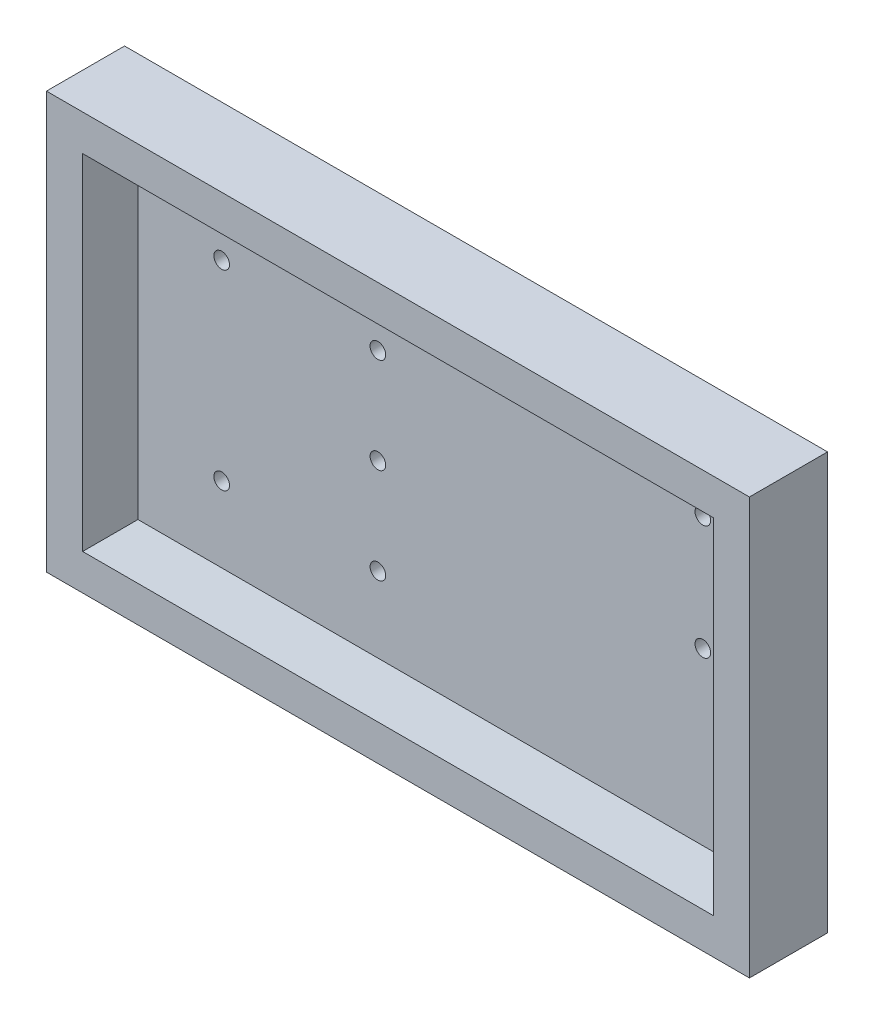
from build123d import *

# Parameters (mm, degrees)
SKETCH1_W           = 135
SKETCH1_H           = 80
BOSS_EXTRUDE1_DEPTH = 40
SKETCH2_R           = 1.5
CUT_EXTRUDE1_DEPTH  = 10
SKETCH4_W           = 135
SKETCH4_H           = 25
CUT_EXTRUDE2_DEPTH  = 100


with BuildPart() as part:
    # Sketch1 → Boss-Extrude1 (new body)
    with BuildSketch(Plane.XY):
        with Locations((67.5, 40)):
            Rectangle(SKETCH1_W, SKETCH1_H)
    extrude(amount=-BOSS_EXTRUDE1_DEPTH)

    # Sketch2 → Cut-Extrude1 (cut)
    with BuildSketch(Plane(origin=(0, 0, -40), x_dir=(-1, 0, 0), z_dir=(0, 0, -1))):
        with Locations((-53.3, 40)):
            Circle(SKETCH2_R)
        with Locations((-53.3, 58.35)):
            Circle(SKETCH2_R)
        with Locations((-53.3, 21.65)):
            Circle(SKETCH2_R)
        with Locations((-23.3, 58.35)):
            Circle(SKETCH2_R)
        with Locations((-23.3, 21.65)):
            Circle(SKETCH2_R)
        with Locations((-115.7, 40)):
            Circle(SKETCH2_R)
        with Locations((-115.7, 62)):
            Circle(SKETCH2_R)
    extrude(amount=-CUT_EXTRUDE1_DEPTH, mode=Mode.SUBTRACT)

    # Cavity1: read off the stored shape, not the designer's step
    # Cavity1: loft between two sections, ruled curve by curve
    cavity1_from = [
        Edge.make_line((128.706, 6.25125, 0), (128.706, 73.74875, 0)),
        Edge.make_line((6.294, 6.25125, 0), (128.706, 6.25125, 0)),
        Edge.make_line((6.294, 73.74875, 0), (6.294, 6.25125, 0)),
        Edge.make_line((128.706, 73.74875, 0), (6.294, 73.74875, 0)),
    ]
    cavity1_to = [
        Edge.make_line((127.780327673, 7.181504864, -35.35), (127.780327673, 72.818495136, -35.35)),
        Edge.make_line((7.219672327, 7.181504864, -35.35), (127.780327673, 7.181504864, -35.35)),
        Edge.make_line((7.219672327, 72.818495136, -35.35), (7.219672327, 7.181504864, -35.35)),
        Edge.make_line((127.780327673, 72.818495136, -35.35), (7.219672327, 72.818495136, -35.35)),
    ]
    cavity1 = Solid(Shell([*[Face.make_surface_from_curves(cavity1_from[k], cavity1_to[k]) for k in range(4)], Face(Wire(cavity1_from)), Face(Wire(cavity1_to))]))
    add(cavity1, mode=Mode.SUBTRACT)

    # Sketch4 → Cut-Extrude2 (cut)
    with BuildSketch(Plane(origin=(0, 80, 0), x_dir=(1, 0, 0), z_dir=(0, 1, 0))):
        with Locations((67.5, 12.5)):
            Rectangle(SKETCH4_W, SKETCH4_H)
    extrude(amount=-CUT_EXTRUDE2_DEPTH, mode=Mode.SUBTRACT)


solid = part.part
